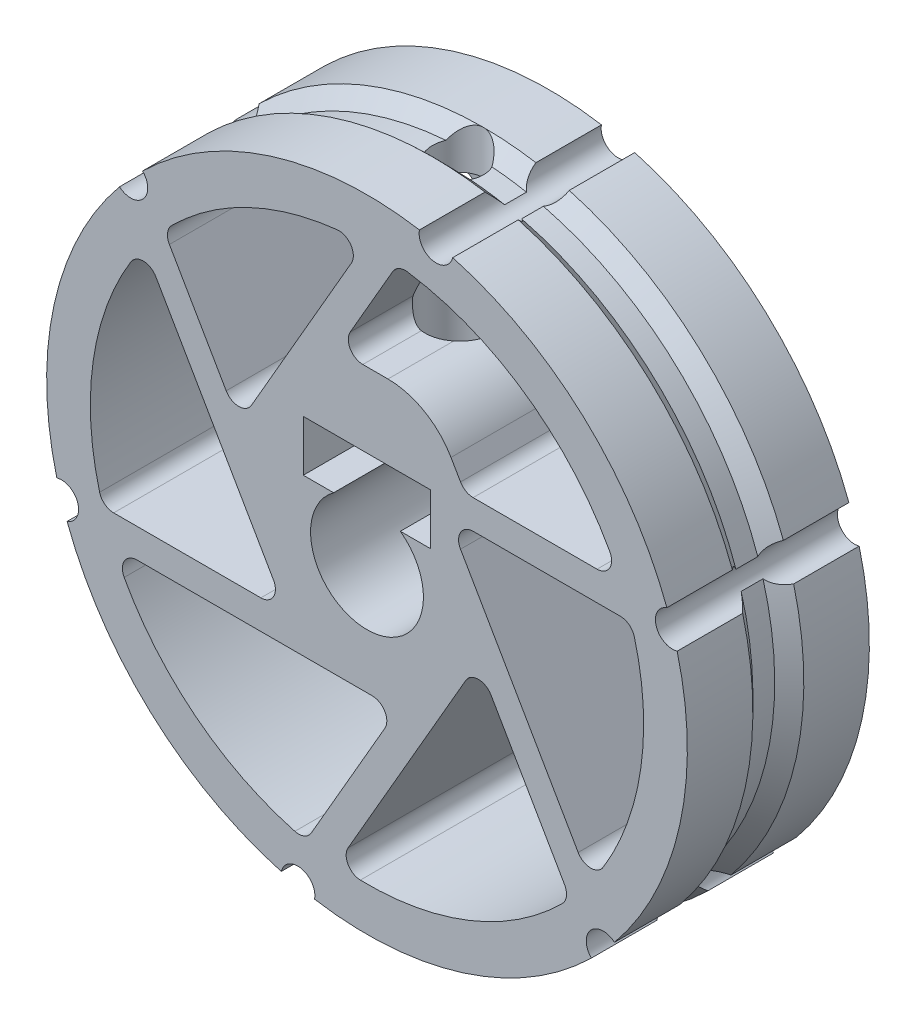
from build123d import *

# Parameters (mm, degrees)
SKETCH1_R              = 17.6
BOSS_EXTRUDE1_DEPTH    = 10
SKETCH3_R              = 0.936975056
CUT_EXTRUDE2_DEPTH     = 27.823869967
FILLET1_R              = 0.8
FILLET2_R              = 0.8
FILLET3_R              = 0.8
CUT_EXTRUDE1_START     = -9.9000001
CUT_EXTRUDE1_OUTLINE_R = 1.8
CUT_EXTRUDE1_DEPTH     = 9.9000001
CUT_EXTRUDE1_START_2   = -1e-07
CUT_EXTRUDE1_2_DEPTH   = 10.0000002
SKETCH6_R              = 1.4
CUT_EXTRUDE3_DEPTH     = 31.564194804
FILLET4_R              = 4


with BuildPart() as part:
    # Sketch1 → Boss-Extrude1 (new body)
    with BuildSketch(Plane.XY):
        Circle(SKETCH1_R)
        with BuildLine():
            Line((1.833030278, 2.5), (3.5, 2.5))
            Line((3.5, 2.5), (3.5, 5.3))
            Line((3.5, 5.3), (-3.5, 5.3))
            Line((-3.5, 5.3), (-3.5, 2.5))
            Line((-3.5, 2.5), (-1.833030278, 2.5))
            ThreePointArc((-1.833030278, 2.5), (0, -3.1), (1.833030278, 2.5))
        make_face(mode=Mode.SUBTRACT)
        with BuildLine():
            Line((-7.043673284, 0), (-12.243897111, 9.007051878))
            ThreePointArc((-12.243897111, 9.007051878), (-14.988930668, 2.524273642), (-14.518608749, -4.5))
            Line((-14.518608749, -4.5), (-4.445597073, -4.5))
            Line((-4.445597073, -4.5), (-7.043673284, 0))
        make_face(mode=Mode.SUBTRACT)
        with BuildLine():
            Line((-3.521836642, -6.1), (-13.922284295, -6.1))
            ThreePointArc((-13.922284295, -6.1), (-9.680550434, -11.718657914), (-3.362190057, -14.823484004))
            Line((-3.362190057, -14.823484004), (1.674315781, -6.1))
            Line((1.674315781, -6.1), (-3.521836642, -6.1))
        make_face(mode=Mode.SUBTRACT)
        with BuildLine():
            Line((3.521836642, -6.1), (-1.678387185, -15.107051878))
            ThreePointArc((-1.678387185, -15.107051878), (5.308380234, -14.242931555), (11.156418691, -10.323484004))
            Line((11.156418691, -10.323484004), (6.119912853, -1.6))
            Line((6.119912853, -1.6), (3.521836642, -6.1))
        make_face(mode=Mode.SUBTRACT)
        with BuildLine():
            Line((7.043673284, 0), (12.243897111, -9.007051878))
            ThreePointArc((12.243897111, -9.007051878), (14.988930668, -2.524273642), (14.518608749, 4.5))
            Line((14.518608749, 4.5), (4.445597073, 4.5))
            Line((4.445597073, 4.5), (7.043673284, 0))
        make_face(mode=Mode.SUBTRACT)
        with BuildLine():
            Line((-11.156418691, 10.323484004), (-7.043673284, 3.2))
            Line((-7.043673284, 3.2), (-3.46132901, 9.404802293))
            Line((-3.46132901, 9.404802293), (-0.115724398, 15.199559463))
            ThreePointArc((-0.115724398, 15.199559463), (-6.140792329, 13.904339955), (-11.156418691, 10.323484004))
        make_face(mode=Mode.SUBTRACT)
        with BuildLine():
            Line((3.46132901, 9.404802293), (5.369357503, 6.1))
            Line((5.369357503, 6.1), (13.922284295, 6.1))
            ThreePointArc((13.922284295, 6.1), (9.007051878, 12.243897111), (1.678387185, 15.107051878))
            Line((1.678387185, 15.107051878), (-1.613808149, 9.404802293))
            Line((-1.613808149, 9.404802293), (3.46132901, 9.404802293))
        make_face(mode=Mode.SUBTRACT)
    extrude(amount=BOSS_EXTRUDE1_DEPTH)

    # Sketch3 → Cut-Extrude2 (cut, through all)
    with BuildSketch(Plane.XY.offset(10)):
        with Locations((-3.80157893, -17.184527856)):
            Circle(SKETCH3_R)
        with Locations((-16.783027141, -5.3)):
            Circle(SKETCH3_R)
        with Locations((-12.98144821, 11.884527856)):
            Circle(SKETCH3_R)
        with Locations((3.80157893, 17.184527856)):
            Circle(SKETCH3_R)
        with Locations((16.783027141, 5.3)):
            Circle(SKETCH3_R)
        with Locations((12.98144821, -11.884527856)):
            Circle(SKETCH3_R)
    extrude(amount=-CUT_EXTRUDE2_DEPTH, mode=Mode.SUBTRACT)

    # Fillet1
    fillet1_edges = [part.edges().sort_by_distance(p)[0] for p in [
        (6.119912853, -1.6, 5),
        (4.445597073, 4.5, 5),
        (-4.445597073, -4.5, 5),
        (1.674315781, -6.1, 5),
        (-7.043673284, 3.2, 5),
        (-1.613808149, 9.404802293, 5),
        (5.369357503, 6.1, 5),
    ]]
    fillet(fillet1_edges, radius=FILLET1_R)

    # Fillet2
    fillet2_edges = [part.edges().sort_by_distance(p)[0] for p in [
        (-1.678387185, -15.107051878, 5),
        (12.243897111, -9.007051878, 5),
        (-12.243897111, 9.007051878, 5),
        (-13.922284295, -6.1, 5),
        (-0.115724398, 15.199559463, 5),
        (13.922284295, 6.1, 5),
    ]]
    fillet(fillet2_edges, radius=FILLET2_R)

    # Fillet3
    fillet3_edges = [part.edges().sort_by_distance(p)[0] for p in [
        (11.156418691, -10.323484004, 5),
        (14.518608749, 4.5, 5),
        (-14.518608749, -4.5, 5),
        (-3.362190057, -14.823484004, 5),
        (-11.156418691, 10.323484004, 5),
        (1.678387185, 15.107051878, 5),
    ]]
    fillet(fillet3_edges, radius=FILLET3_R)

    # Cut-Extrude1: read off the stored shape, not the designer's step
    # Cut-Extrude1 outline → Cut-Extrude1 (cut)
    with BuildSketch(Plane.XZ.offset(-5.3).offset(CUT_EXTRUDE1_START)):
        with Locations((0, 5)):
            Circle(CUT_EXTRUDE1_OUTLINE_R)
    extrude(amount=CUT_EXTRUDE1_DEPTH, mode=Mode.SUBTRACT)

    # Cut-Extrude1 2 outline → Cut-Extrude1 2 (add)
    with BuildSketch(Plane.XY.offset(CUT_EXTRUDE1_START_2)):
        with BuildLine():
            Line((-3, 15.2000001), (-3, 14.901006677))
            ThreePointArc((-3, 14.901006677), (-1.507431342, 15.125066967), (1e-09, 15.2))
            Line((1e-09, 15.2), (-3, 15.2000001))
        make_face()
        with BuildLine():
            Line((3, 15.2000001), (1e-09, 15.2))
            ThreePointArc((1e-09, 15.2), (0.901587577, 15.173237619), (1.800000334, 15.093044716))
            Line((1.800000334, 15.093044716), (3, 14.949932452))
            Line((3, 14.949932452), (3, 15.2000001))
        make_face()
    extrude(amount=CUT_EXTRUDE1_2_DEPTH)

    # Sketch6 → Cut-Extrude3 (cut, through all)
    with BuildSketch(Plane.XZ.offset(-5.3)):
        with Locations((0, 5)):
            Circle(SKETCH6_R)
    extrude(amount=-CUT_EXTRUDE3_DEPTH, mode=Mode.SUBTRACT)

    # Fillet4
    # the kernel refuses this fillet: 4 mm, written as the material it takes off along each edge
    with BuildSketch(Plane(origin=(3.46132901, 9.404802293, -5.773502692), x_dir=(0.4999999999999997, -0.8660254037844388, 0), z_dir=(0, 0, 1))) as fillet4_piece_1:
        with BuildLine():
            CenterArc((FILLET4_R * 0.57735026919, -FILLET4_R), FILLET4_R, 90, 60)
            Line((-FILLET4_R * 0.288675134595, -FILLET4_R * 0.5), (0, 0))
            Line((0, 0), (FILLET4_R * 0.57735026919, 0))
        make_face()
    extrude(amount=21.547005384, mode=Mode.SUBTRACT)

    # Sketch5 → Cut-Revolve1 (revolve, cut)
    with BuildSketch(Plane(origin=(0, 0, 0), x_dir=(1, 0, 0), z_dir=(0, 1, 0))):
        Polygon((-17.6, -3.6), (-17.6, -6.4), (-16.8, -5.6), (-16.8, -4.4), align=None)
    revolve(axis=Axis((0, 0, 10), (0, 0, -1)), mode=Mode.SUBTRACT)


solid = part.part
